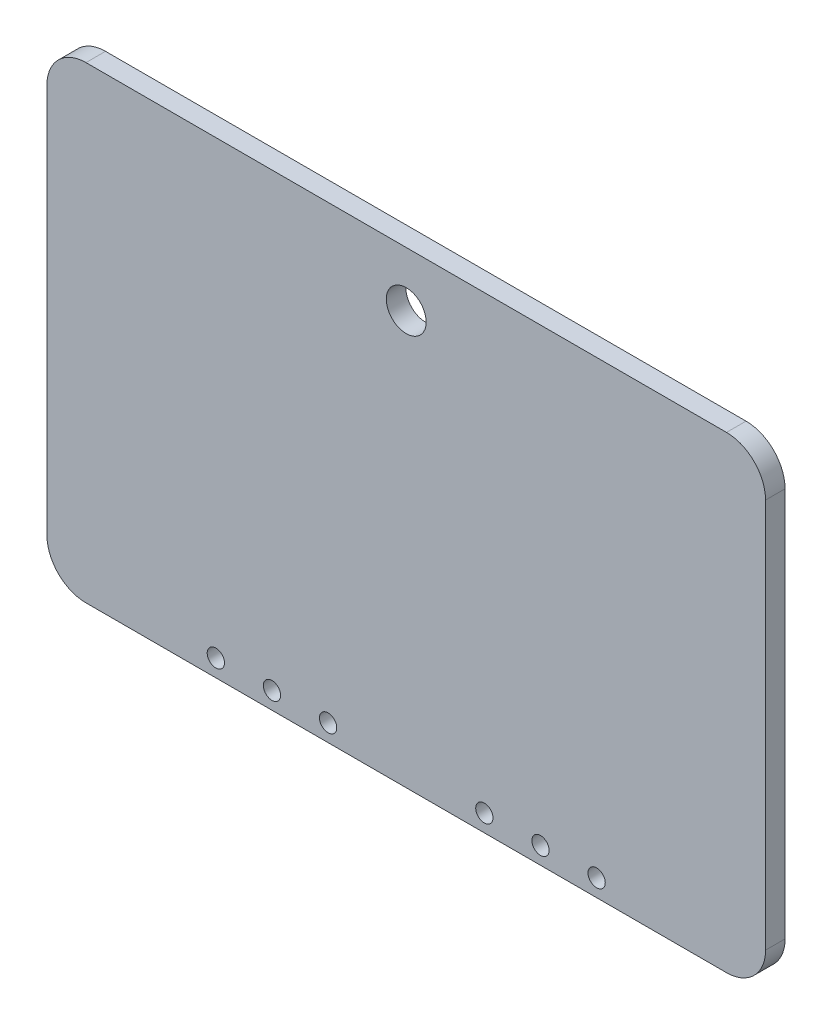
from build123d import *

# Parameters (mm, degrees)
SKETCH1_W              = 233.68
SKETCH1_H              = 152.146
BOSS_EXTRUDE1_DEPTH    = 6.35
F_10_CLEARANCE_HOLE1_D = 5.6134
SKETCH8_R              = 6.477
CUT_EXTRUDE1_DEPTH     = 279.917676414
FILLET1_R              = 12.7


with BuildPart() as part:
    # Sketch1 → Boss-Extrude1 (new body)
    with BuildSketch(Plane.XY):
        with Locations((116.84, 76.073)):
            Rectangle(SKETCH1_W, SKETCH1_H)
    extrude(amount=BOSS_EXTRUDE1_DEPTH)

    # #10 Clearance Hole1 (through all)
    with Locations(Plane.XY.offset(6.35)):
        with Locations((54.9275, 5.588), (91.44, 5.588), (142.24, 5.588), (178.7525, 5.588), (73.18375, 5.588), (160.49625, 5.588)):
            Hole(F_10_CLEARANCE_HOLE1_D / 2)

    # Sketch8 → Cut-Extrude1 (cut, through all)
    with BuildSketch(Plane.XY.offset(6.35)):
        with Locations((116.84, 134.366)):
            Circle(SKETCH8_R)
    extrude(amount=-CUT_EXTRUDE1_DEPTH, mode=Mode.SUBTRACT)

    # Fillet1
    fillet1_edges = [part.edges().sort_by_distance(p)[0] for p in [
        (233.68, 0, 3.175),
        (233.68, 152.146, 3.175),
        (0, 152.146, 3.175),
        (0, 0, 3.175),
    ]]
    fillet(fillet1_edges, radius=FILLET1_R)


solid = part.part
